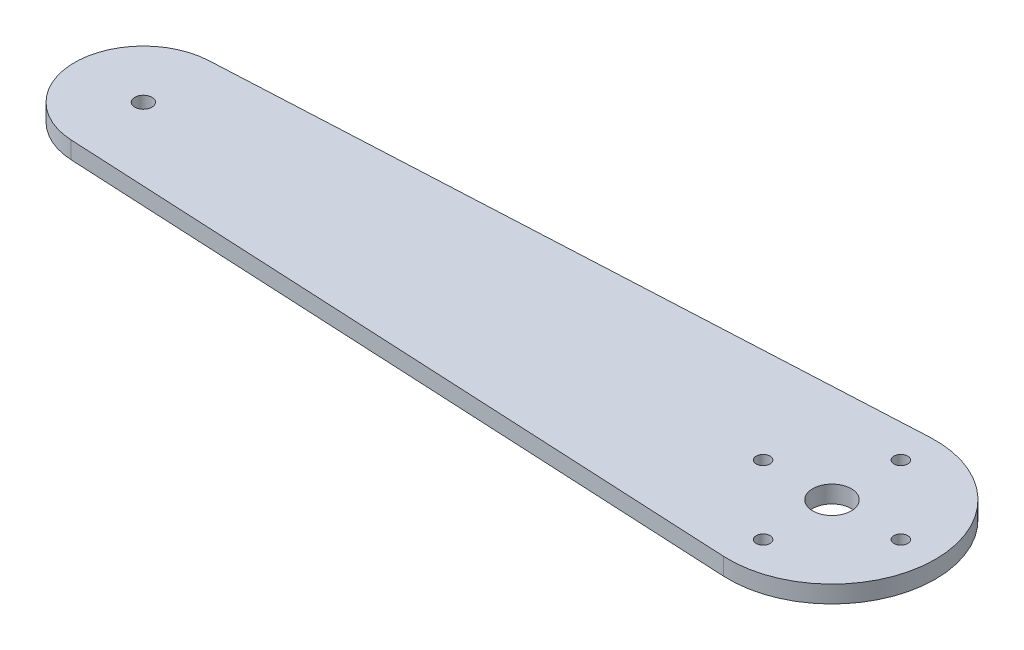
from build123d import *

# Parameters (mm, degrees)
SKETCH1_R           = 1.5875
SKETCH1_R_2         = 3.556
SKETCH1_R_3         = 1.27
BOSS_EXTRUDE1_DEPTH = 3.175


with BuildPart() as part:
    # Sketch1 → Boss-Extrude1 (new body)
    with BuildSketch(Plane(origin=(0, 0, 0), x_dir=(1, 0, 0), z_dir=(0, 1, 0))):
        with BuildLine():
            Line((-127.635, 12.684115066), (-0.9525, 19.026172599))
            ThreePointArc((-0.9525, 19.026172599), (19.05, 0), (-0.9525, -19.026172599))
            Line((-0.9525, -19.026172599), (-127.635, -12.684115066))
            ThreePointArc((-127.635, -12.684115066), (-139.7, 0), (-127.635, 12.684115066))
        make_face()
        with Locations((-127, 0)):
            Circle(SKETCH1_R, mode=Mode.SUBTRACT)
        Circle(SKETCH1_R_2, mode=Mode.SUBTRACT)
        with Locations((0, 12.7)):
            Circle(SKETCH1_R_3, mode=Mode.SUBTRACT)
        with Locations((12.7, 0)):
            Circle(SKETCH1_R_3, mode=Mode.SUBTRACT)
        with Locations((0, -12.7)):
            Circle(SKETCH1_R_3, mode=Mode.SUBTRACT)
        with Locations((-12.7, 0)):
            Circle(SKETCH1_R_3, mode=Mode.SUBTRACT)
    extrude(amount=BOSS_EXTRUDE1_DEPTH)


solid = part.part
